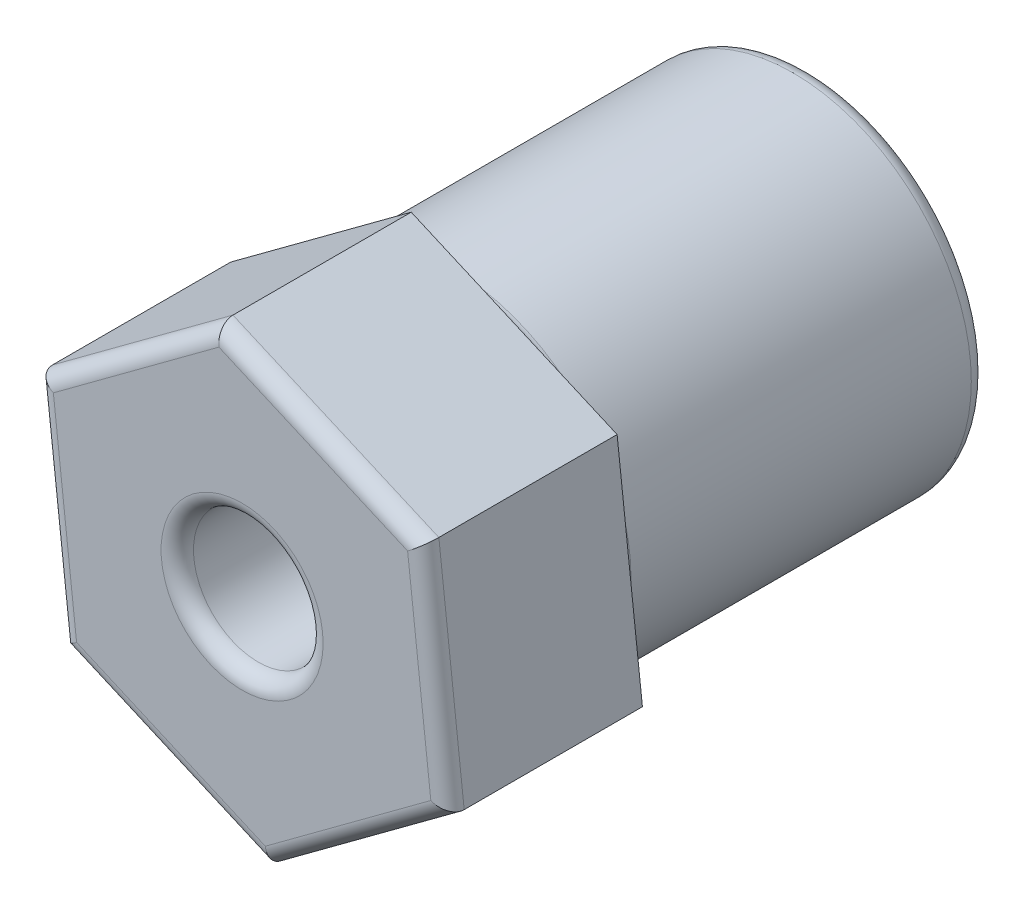
from build123d import *

# Parameters (mm, degrees)
EXTRUDE_1_DEPTH     = 6
SKETCH_2_R          = 5.5
EXTRUDE_2_DEPTH     = 11.5
SKETCH_3_R          = 2
CUT_EXTRUDE_1_DEPTH = 17.5
FILLET_1_R          = 0.5
FILLET_2_R          = 0.5
FILLET_3_R          = 0.5


with BuildPart() as part:
    # 草图1 → 凸台-拉伸1 (new body)
    with BuildSketch(Plane.XY):
        Polygon((-6.352433325, 2.765246979), (-5.570990794, -4.118745146), (0.781442531, -6.883992125), (6.352433325, -2.765246979), (5.570990794, 4.118745146), (-0.781442531, 6.883992125), align=None)
    extrude(amount=EXTRUDE_1_DEPTH)

    # 草图2 → 凸台-拉伸2 (add)
    with BuildSketch(Plane.XY):
        Circle(SKETCH_2_R)
    extrude(amount=-EXTRUDE_2_DEPTH)

    # 草图3 → 切除-拉伸1 (cut)
    with BuildSketch(Plane(origin=(0, 0, -11.5), x_dir=(-1, 0, 0), z_dir=(0, 0, -1))):
        Circle(SKETCH_3_R)
    extrude(amount=-CUT_EXTRUDE_1_DEPTH, mode=Mode.SUBTRACT)

    # 圆角1
    fillet_1_edges = [part.edges().sort_by_distance(p)[0] for p in [
        (-5.5, 0, 0),
    ]]
    fillet(fillet_1_edges, radius=FILLET_1_R - 0.0001)  # a hair under: the kernel refuses the full size

    # 圆角2
    fillet_2_edges = [part.edges().sort_by_distance(p)[0] for p in [
        (-2.394774131, -5.501368635, 6),
        (3.566937928, -4.824619552, 6),
        (5.961712059, 0.676749083, 6),
        (-5.5, 0, -11.5),
        (2.394774131, 5.501368635, 6),
        (-3.566937928, 4.824619552, 6),
        (-5.961712059, -0.676749083, 6),
    ]]
    fillet(fillet_2_edges, radius=FILLET_2_R)

    # 圆角3
    fillet_3_edges = [part.edges().sort_by_distance(p)[0] for p in [
        (2, 0, -11.5),
        (2, 0, 6),
    ]]
    fillet(fillet_3_edges, radius=FILLET_3_R)


solid = part.part
